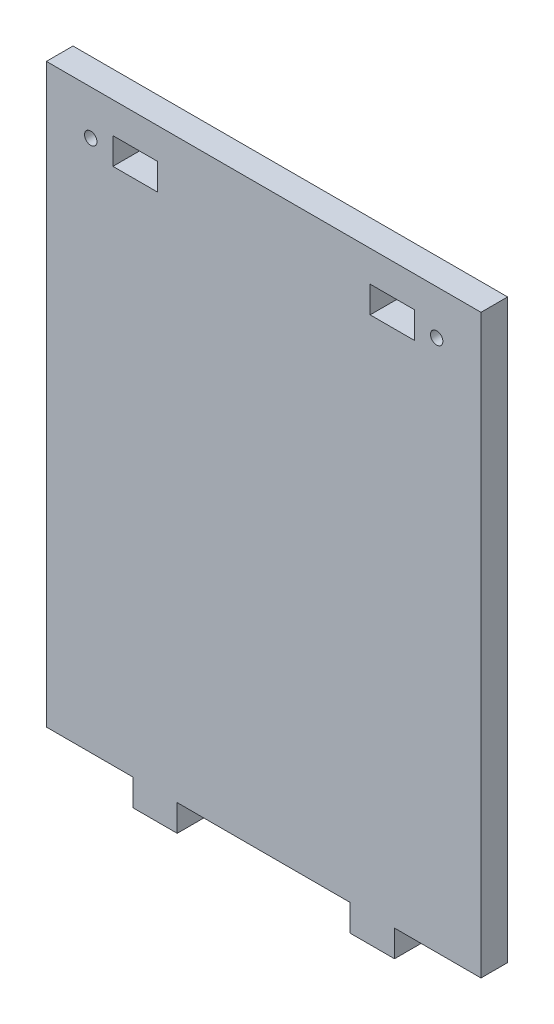
from build123d import *

# Parameters (mm, degrees)
ESQUISSE1_W             = 98
ESQUISSE1_H             = 130
ESQUISSE1_W_2           = 10
ESQUISSE1_H_2           = 6
BOSS_EXTRU_1_DEPTH      = 6
ESQUISSE2_W             = 10
ESQUISSE2_H             = 6
BOSS_EXTRU_2_DEPTH      = 6
ESQUISSE3_R             = 1.4
ENL_V_MAT_EXTRU_1_DEPTH = 6


with BuildPart() as part:
    # Esquisse1 → Boss.-Extru.1 (new body)
    with BuildSketch(Plane.XY):
        Rectangle(ESQUISSE1_W, ESQUISSE1_H)
        with Locations((29, 55)):
            Rectangle(ESQUISSE1_W_2, ESQUISSE1_H_2, mode=Mode.SUBTRACT)
        with Locations((-29, 55)):
            Rectangle(ESQUISSE1_W_2, ESQUISSE1_H_2, mode=Mode.SUBTRACT)
    extrude(amount=BOSS_EXTRU_1_DEPTH)

    # Esquisse2 → Boss.-Extru.2 (add)
    with BuildSketch(Plane.XY.offset(6)):
        with Locations((24.5, -68)):
            Rectangle(ESQUISSE2_W, ESQUISSE2_H)
        with Locations((-24.5, -68)):
            Rectangle(ESQUISSE2_W, ESQUISSE2_H)
    extrude(amount=-BOSS_EXTRU_2_DEPTH)

    # Esquisse3 → Enlèv. mat.-Extru.1 (cut)
    with BuildSketch(Plane.XY.offset(6)):
        with Locations((-39, 55)):
            Circle(ESQUISSE3_R)
        with Locations((39, 55)):
            Circle(ESQUISSE3_R)
    extrude(amount=-ENL_V_MAT_EXTRU_1_DEPTH, mode=Mode.SUBTRACT)


solid = part.part
